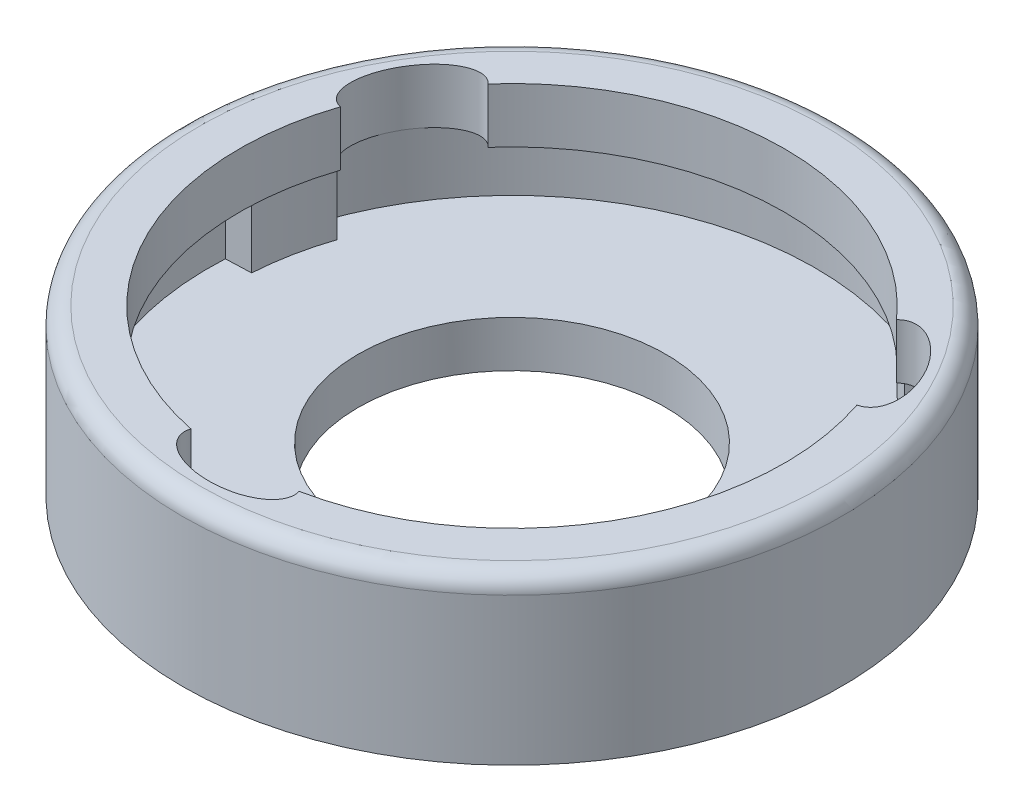
from build123d import *
from build123d.topology import SkipClean

# Parameters (mm, degrees)
SKIZZE1_R                       = 7.5
SKIZZE1_R_2                     = 3.5
AUFSATZ_LINEAR_AUSTRAGEN2_DEPTH = 0.8
SKIZZE5_R                       = 7.5
SKIZZE5_R_2                     = 6.9
AUFSATZ_LINEAR_AUSTRAGEN4_DEPTH = 1.7
SKIZZE18_R                      = 7.5
SKIZZE18_R_2                    = 6.2
AUFSATZ_LINEAR_AUSTRAGEN5_DEPTH = 1.25
SKIZZE19_RX                     = 1.25
SKIZZE19_RY                     = 0.7
SCHNITT_LINEAR_AUSTRAGEN1_DEPTH = 1.75
AUFSATZ_LINEAR_AUSTRAGEN6_DEPTH = 1.7
AUFSATZ_LINEAR_AUSTRAGEN7_DEPTH = 0.25
KREISMUSTER2_COUNT              = 3
KREISMUSTER4_COUNT              = 3
VERRUNDUNG1_R                   = 0.4


with BuildPart() as part:
    # Skizze1 → Aufsatz-Linear austragen2 (new body)
    with BuildSketch(Plane(origin=(0, 0, 0), x_dir=(1, 0, 0), z_dir=(0, 1, 0))):
        Circle(SKIZZE1_R)
        Circle(SKIZZE1_R_2, mode=Mode.SUBTRACT)
    extrude(amount=AUFSATZ_LINEAR_AUSTRAGEN2_DEPTH)

    # Skizze5 → Aufsatz-Linear austragen4 (add)
    with BuildSketch(Plane(origin=(0, 0.8, 0), x_dir=(1, 0, 0), z_dir=(0, 1, 0))):
        Circle(SKIZZE5_R)
        Circle(SKIZZE5_R_2, mode=Mode.SUBTRACT)
    extrude(amount=AUFSATZ_LINEAR_AUSTRAGEN4_DEPTH)

    # Skizze18 → Aufsatz-Linear austragen5 (add)
    with BuildSketch(Plane(origin=(0, 2.5, 0), x_dir=(1, 0, 0), z_dir=(0, 1, 0))):
        Circle(SKIZZE18_R)
        Circle(SKIZZE18_R_2, mode=Mode.SUBTRACT)
    extrude(amount=AUFSATZ_LINEAR_AUSTRAGEN5_DEPTH)

    # Skizze19 → Schnitt-Linear austragen1 (cut)
    with BuildSketch(Plane(origin=(0, 3.75, 0), x_dir=(1, 0, 0), z_dir=(0, 1, 0))):
        with Locations(Location((0, -6.2), (0, 0, 180))):
            Ellipse(SKIZZE19_RX, SKIZZE19_RY)
    schnitt_linear_austragen1 = extrude(amount=-SCHNITT_LINEAR_AUSTRAGEN1_DEPTH, mode=Mode.SUBTRACT)

    # Skizze21 → Aufsatz-Linear austragen6 (add)
    with SkipClean():  # the faces are left unmerged after this step: merging them gives an invalid solid
        with BuildSketch(Plane(origin=(0, 0.8, 0), x_dir=(1, 0, 0), z_dir=(0, 1, 0))):
            with BuildLine():
                Line((1.25, -6.2), (1.58338324, -7.330954748))
                ThreePointArc((1.58338324, -7.330954748), (2.538105919, -7.057479603), (3.448325605, -6.660259043))
                Line((3.448325605, -6.660259043), (2.820309034, -5.661126827))
                ThreePointArc((2.820309034, -5.661126827), (2.052912561, -5.982311428), (1.25, -6.2))
            make_face()
        aufsatz_linear_austragen6 = extrude(amount=AUFSATZ_LINEAR_AUSTRAGEN6_DEPTH)

    # Skizze22 → Aufsatz-Linear austragen7 (add)
    with SkipClean():  # the faces are left unmerged after this step: merging them gives an invalid solid
        with BuildSketch(Plane(origin=(0, 0.8, 0), x_dir=(1, 0, 0), z_dir=(0, 1, 0))):
            with BuildLine():
                Line((1.161835681, -3.301535681), (2.290476057, -6.50874177))
                ThreePointArc((2.290476057, -6.50874177), (0, 6.9), (-2.290476057, -6.50874177))
                Line((-2.290476057, -6.50874177), (-1.161835681, -3.301535681))
                ThreePointArc((-1.161835681, -3.301535681), (0, 3.5), (1.161835681, -3.301535681))
            make_face()
        extrude(amount=AUFSATZ_LINEAR_AUSTRAGEN7_DEPTH)

    # Kreismuster2: Schnitt-Linear austragen1 ×3 about axis
    with SkipClean():  # the faces are left unmerged after this step: merging them gives an invalid solid
        kreismuster2_axis = Axis((0, 3.75, 0), (0, -1, 0))
        for i in range(1, KREISMUSTER2_COUNT):
            add(schnitt_linear_austragen1.rotate(kreismuster2_axis, i * 360 / KREISMUSTER2_COUNT), mode=Mode.SUBTRACT)

    # Kreismuster4: Aufsatz-Linear austragen6 ×3 about axis
    with SkipClean():  # the faces are left unmerged after this step: merging them gives an invalid solid
        kreismuster4_axis = Axis((0, 2.5, 0), (0, -1, 0))
        for i in range(1, KREISMUSTER4_COUNT):
            add(aufsatz_linear_austragen6.rotate(kreismuster4_axis, i * 360 / KREISMUSTER4_COUNT))

    # Verrundung1
    verrundung1_edges = [part.edges().sort_by_distance(p)[0] for p in [
        (-7.5, 3.75, 0),
    ]]
    fillet(verrundung1_edges, radius=VERRUNDUNG1_R)


solid = part.part
